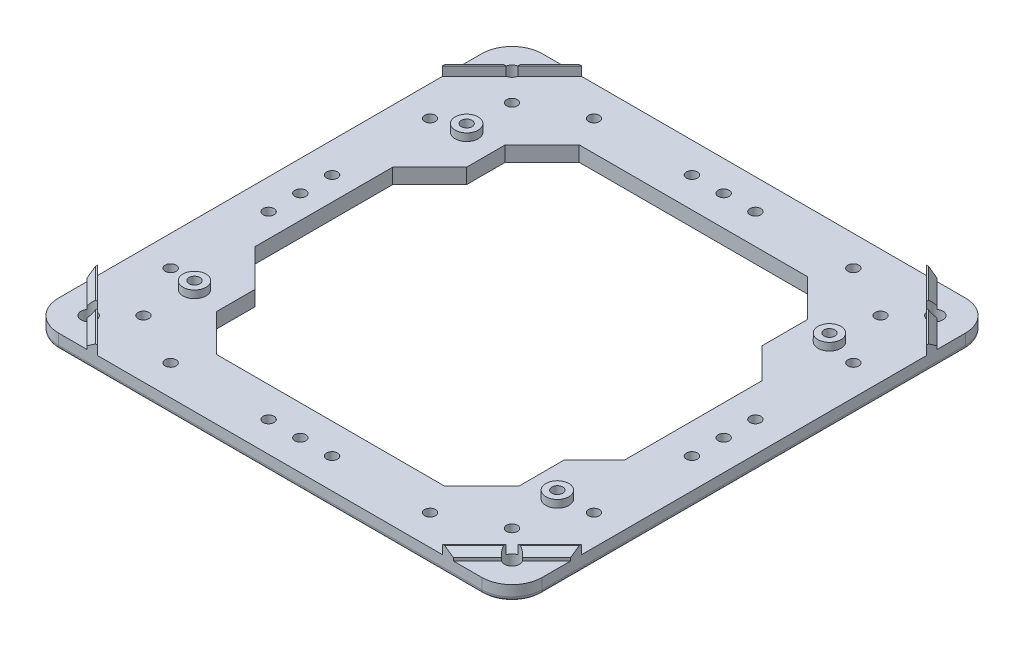
from build123d import *
from build123d.topology import SkipClean

# Parameters (mm, degrees)
SKETCH1_W           = 203.2
SKETCH1_H           = 203.2
BOSS_EXTRUDE1_DEPTH = 6.35
FILLET1_R           = 12.7
SKETCH2_R           = 3.175
CUT_EXTRUDE1_DEPTH  = 288.438345563
FILLET2_R           = 1.905
SKETCH3_R           = 2.286
CUT_EXTRUDE2_DEPTH  = 288.438345634
SKETCH4_R           = 2.286
CUT_EXTRUDE3_DEPTH  = 288.438345634
SKETCH5_R           = 4.826
SKETCH5_R_2         = 2.286
BOSS_EXTRUDE2_DEPTH = 3.175
BOSS_EXTRUDE3_DEPTH = 3.81
CHAMFER1_SIZE       = 2.54
CUT_EXTRUDE4_DEPTH  = 288.438345634
CHAMFER2_SIZE       = 15.5448
SKETCH8_R           = 2.286
CUT_EXTRUDE5_DEPTH  = 288.438345634


with BuildPart() as part:
    # Sketch1 → Boss-Extrude1 (new body)
    with BuildSketch(Plane(origin=(0, 0, 0), x_dir=(1, 0, 0), z_dir=(0, 1, 0))):
        with Locations((101.6, 101.6)):
            Rectangle(SKETCH1_W, SKETCH1_H)
    extrude(amount=BOSS_EXTRUDE1_DEPTH)

    # Fillet1
    fillet1_edges = [part.edges().sort_by_distance(p)[0] for p in [
        (0, 3.175, -203.2),
        (203.2, 3.175, -203.2),
        (203.2, 3.175, 0),
        (0, 3.175, 0),
    ]]
    fillet(fillet1_edges, radius=FILLET1_R)

    # Sketch2 → Cut-Extrude1 (cut, through all)
    with BuildSketch(Plane.XZ):
        with Locations(Location((12.7, -12.7, 0), (0, 0, 270))):
            Circle(SKETCH2_R)
        with Locations(Location((190.5, -12.7, 0), (0, 0, 270))):
            Circle(SKETCH2_R)
        with Locations(Location((190.5, -190.5, 0), (0, 0, 270))):
            Circle(SKETCH2_R)
        with Locations(Location((12.7, -190.5, 0), (0, 0, 270))):
            Circle(SKETCH2_R)
    extrude(amount=-CUT_EXTRUDE1_DEPTH, mode=Mode.SUBTRACT)

    # Fillet2
    fillet2_edges = [part.edges().sort_by_distance(p)[0] for p in [
        (0, 0, -101.6),
        (101.6, 0, -203.2),
        (203.2, 0, -101.6),
        (101.6, 0, 0),
        (199.480256121, 0, -199.480256121),
        (199.480256121, 0, -3.719743879),
        (3.719743879, 0, -3.719743879),
        (3.719743879, 0, -199.480256121),
    ]]
    fillet(fillet2_edges, radius=FILLET2_R)

    # Sketch3 → Cut-Extrude2 (cut, through all)
    with BuildSketch(Plane(origin=(0, 6.35, 0), x_dir=(1, 0, 0), z_dir=(0, 1, 0))):
        with Locations(Location((24.197781122, 24.197781122, 0), (0, 0, 270))):
            Circle(SKETCH3_R)
        with Locations(Location((179.002218878, 179.002218878, 0), (0, 0, 270))):
            Circle(SKETCH3_R)
        with Locations(Location((179.002218878, 24.197781122, 0), (0, 0, 270))):
            Circle(SKETCH3_R)
        with Locations(Location((24.197781122, 179.002218878, 0), (0, 0, 270))):
            Circle(SKETCH3_R)
    extrude(amount=-CUT_EXTRUDE2_DEPTH, mode=Mode.SUBTRACT)

    # Sketch4 → Cut-Extrude3 (cut, through all)
    with BuildSketch(Plane(origin=(0, 6.35, 0), x_dir=(1, 0, 0), z_dir=(0, 1, 0))):
        with Locations(Location((47.117, 12.7, 0), (0, 0, 270))):
            Circle(SKETCH4_R)
        with Locations(Location((156.083, 12.7, 0), (0, 0, 270))):
            Circle(SKETCH4_R)
        with Locations(Location((12.7, 156.083, 0), (0, 0, 270))):
            Circle(SKETCH4_R)
        with Locations(Location((12.7, 47.117, 0), (0, 0, 270))):
            Circle(SKETCH4_R)
        with Locations(Location((156.083, 190.5, 0), (0, 0, 270))):
            Circle(SKETCH4_R)
        with Locations(Location((47.117, 190.5, 0), (0, 0, 270))):
            Circle(SKETCH4_R)
        with Locations(Location((190.5, 47.117, 0), (0, 0, 270))):
            Circle(SKETCH4_R)
        with Locations(Location((190.5, 156.083, 0), (0, 0, 270))):
            Circle(SKETCH4_R)
        with Locations(Location((101.6, 12.7, 0), (0, 0, 270))):
            Circle(SKETCH4_R)
        with Locations(Location((12.7, 101.6, 0), (0, 0, 270))):
            Circle(SKETCH4_R)
        with Locations(Location((101.6, 190.5, 0), (0, 0, 270))):
            Circle(SKETCH4_R)
        with Locations(Location((190.5, 101.6, 0), (0, 0, 270))):
            Circle(SKETCH4_R)
    extrude(amount=-CUT_EXTRUDE3_DEPTH, mode=Mode.SUBTRACT)

    # Sketch5 → Boss-Extrude2 (add)
    # profile 1 of 4: a face of its own
    with BuildSketch(Plane(origin=(0, 6.35, 0), x_dir=(1, 0, 0), z_dir=(0, 1, 0))):
        with Locations(Location((25.4, 158.75, 0), (0, 0, 90))):
            Circle(SKETCH5_R)
        with Locations(Location((25.4, 158.75, 0), (0, 0, 270))):
            Circle(SKETCH5_R_2, mode=Mode.SUBTRACT)
    # profile 2 of 4: a face of its own
    with BuildSketch(Plane(origin=(0, 6.35, 0), x_dir=(1, 0, 0), z_dir=(0, 1, 0))):
        with Locations(Location((177.8, 158.75, 0), (0, 0, 90))):
            Circle(SKETCH5_R)
        with Locations(Location((177.8, 158.75, 0), (0, 0, 270))):
            Circle(SKETCH5_R_2, mode=Mode.SUBTRACT)
    # profile 3 of 4: a face of its own
    with BuildSketch(Plane(origin=(0, 6.35, 0), x_dir=(1, 0, 0), z_dir=(0, 1, 0))):
        with Locations(Location((177.8, 44.45, 0), (0, 0, 90))):
            Circle(SKETCH5_R)
        with Locations(Location((177.8, 44.45, 0), (0, 0, 270))):
            Circle(SKETCH5_R_2, mode=Mode.SUBTRACT)
    # profile 4 of 4: a face of its own
    with BuildSketch(Plane(origin=(0, 6.35, 0), x_dir=(1, 0, 0), z_dir=(0, 1, 0))):
        with Locations(Location((25.4, 44.45, 0), (0, 0, 90))):
            Circle(SKETCH5_R)
        with Locations(Location((25.4, 44.45, 0), (0, 0, 270))):
            Circle(SKETCH5_R_2, mode=Mode.SUBTRACT)
    extrude(amount=BOSS_EXTRUDE2_DEPTH)

    # Sketch6 → Boss-Extrude3 (add)
    with SkipClean():  # the faces are left unmerged after this step: merging them gives an invalid solid
        with BuildSketch(Plane(origin=(0, 6.35, 0), x_dir=(1, 0, 0), z_dir=(0, 1, 0))):
            with BuildLine():
                Line((203.2, 29.12872), (189.886429467, 15.815149467))
                ThreePointArc((189.886429467, 15.815149467), (191.679620112, 15.647731567), (193.093253903, 14.531845843))
                Line((193.093253903, 14.531845843), (203.2, 24.638591939))
                Line((203.2, 24.638591939), (203.2, 29.12872))
            make_face()
            with BuildLine():
                Line((178.561408061, 0), (174.07128, 0))
                Line((174.07128, 0), (187.384850533, 13.313570533))
                ThreePointArc((187.384850533, 13.313570533), (187.552268433, 11.520379888), (188.668154157, 10.106746097))
                Line((188.668154157, 10.106746097), (178.561408061, 0))
            make_face()
            with BuildLine():
                Line((13.313570533, 15.815149467), (0, 29.12872))
                Line((0, 29.12872), (0, 24.638591939))
                Line((0, 24.638591939), (10.106746097, 14.531845843))
                ThreePointArc((10.106746097, 14.531845843), (11.520379888, 15.647731567), (13.313570533, 15.815149467))
            make_face()
            with BuildLine():
                Line((24.638591939, 0), (14.531845843, 10.106746097))
                ThreePointArc((14.531845843, 10.106746097), (15.647731567, 11.520379888), (15.815149467, 13.313570533))
                Line((15.815149467, 13.313570533), (29.12872, 0))
                Line((29.12872, 0), (24.638591939, 0))
            make_face()
            with BuildLine():
                Line((15.815149467, 189.886429467), (29.12872, 203.2))
                Line((29.12872, 203.2), (24.638591939, 203.2))
                Line((24.638591939, 203.2), (14.531845843, 193.093253903))
                ThreePointArc((14.531845843, 193.093253903), (15.647731567, 191.679620112), (15.815149467, 189.886429467))
            make_face()
            with BuildLine():
                Line((0, 178.561408061), (10.106746097, 188.668154157))
                ThreePointArc((10.106746097, 188.668154157), (11.520379888, 187.552268433), (13.313570533, 187.384850533))
                Line((13.313570533, 187.384850533), (0, 174.07128))
                Line((0, 174.07128), (0, 178.561408061))
            make_face()
            with BuildLine():
                Line((189.886429467, 187.384850533), (203.2, 174.07128))
                Line((203.2, 174.07128), (203.2, 178.561408061))
                Line((203.2, 178.561408061), (193.093253903, 188.668154157))
                ThreePointArc((193.093253903, 188.668154157), (191.679620112, 187.552268433), (189.886429467, 187.384850533))
            make_face()
            with BuildLine():
                Line((178.561408061, 203.2), (188.668154157, 193.093253903))
                ThreePointArc((188.668154157, 193.093253903), (187.552268433, 191.679620112), (187.384850533, 189.886429467))
                Line((187.384850533, 189.886429467), (174.07128, 203.2))
                Line((174.07128, 203.2), (178.561408061, 203.2))
            make_face()
        extrude(amount=BOSS_EXTRUDE3_DEPTH)

    # Chamfer1
    chamfer1_edges = [part.edges().sort_by_distance(p)[0] for p in [
        (198.146626952, 10.16, -19.585218891),
        (183.614781109, 10.16, -5.053373048),
        (19.585218891, 10.16, -5.053373048),
        (5.053373048, 10.16, -19.585218891),
        (5.053373048, 10.16, -183.614781109),
        (19.585218891, 10.16, -198.146626952),
        (183.614781109, 10.16, -198.146626952),
        (198.146626952, 10.16, -183.614781109),
    ]]
    chamfer(chamfer1_edges, length=CHAMFER1_SIZE)

    # Sketch7 → Cut-Extrude4 (cut, through all)
    with BuildSketch(Plane(origin=(0, 6.35, 0), x_dir=(1, 0, 0), z_dir=(0, 1, 0))):
        Polygon((38.1, 57.15), (38.1, 25.4), (165.1, 25.4), (165.1, 57.15), (177.8, 57.15), (177.8, 146.05), (165.1, 146.05), (165.1, 177.8), (38.1, 177.8), (38.1, 146.05), (22.56850138, 146.05), (22.56850138, 57.15), align=None)
    extrude(amount=-CUT_EXTRUDE4_DEPTH, mode=Mode.SUBTRACT)

    # Chamfer2
    # the kernel refuses this chamfer: 15.5448 mm, written as the material it adds along each edge
    with BuildSketch(Plane(origin=(22.56850138, 6.35, -57.15), x_dir=(-0.027495876610586303, 0, -0.9996219169112966), z_dir=(0, -1, 0))) as chamfer2_piece_1_section:
        Polygon((CHAMFER2_SIZE * 0.999621916911, CHAMFER2_SIZE * 0.0274958766106), (-CHAMFER2_SIZE * 0.0274958766106, CHAMFER2_SIZE * 0.999621916911), (0, 0), align=None)
    chamfer2_piece_1 = extrude(amount=6.35, mode=Mode.PRIVATE)
    chamfer2_piece_1 = split(chamfer2_piece_1, bisect_by=Plane(origin=(38.1, 3.175, -62.286463207), z_dir=(-1, 0, 0)), keep=Keep.TOP, mode=Mode.PRIVATE)
    add(chamfer2_piece_1)
    with BuildSketch(Plane(origin=(38.1, 6.35, -25.4), x_dir=(-0.027495876610586754, 0, -0.9996219169112966), z_dir=(0, -1, 0)), Plane(origin=(165.1, 6.35, -25.4), x_dir=(-0.9996219169112966, 0, 0.027495876610586292), z_dir=(0, -1, 0)), Plane(origin=(165.1, 6.35, -177.8), x_dir=(0.027495876610586292, 0, 0.9996219169112966), z_dir=(0, -1, 0)), Plane(origin=(38.1, 6.35, -177.8), x_dir=(0.9996219169112966, 0, -0.027495876610586317), z_dir=(0, -1, 0))) as chamfer2_piece_2:
        Polygon((CHAMFER2_SIZE * 0.999621916911, CHAMFER2_SIZE * 0.0274958766106), (-CHAMFER2_SIZE * 0.0274958766106, CHAMFER2_SIZE * 0.999621916911), (0, 0), align=None)
    extrude(amount=6.35)
    with BuildSketch(Plane(origin=(177.8, 6.35, -57.15), x_dir=(-0.9996219169112966, 0, 0.027495876610586292), z_dir=(0, -1, 0))) as chamfer2_piece_3_section:
        Polygon((CHAMFER2_SIZE * 0.999621916911, CHAMFER2_SIZE * 0.0274958766106), (-CHAMFER2_SIZE * 0.0274958766106, CHAMFER2_SIZE * 0.999621916911), (0, 0), align=None)
    chamfer2_piece_3 = extrude(amount=6.35, mode=Mode.PRIVATE)
    chamfer2_piece_3 = split(chamfer2_piece_3, bisect_by=Plane(origin=(165.1, 3.175, -62.494102003), z_dir=(1, 0, 0)), keep=Keep.TOP, mode=Mode.PRIVATE)
    add(chamfer2_piece_3)
    with BuildSketch(Plane(origin=(177.8, 6.35, -146.05), x_dir=(0.027495876610586292, 0, 0.9996219169112966), z_dir=(0, -1, 0))) as chamfer2_piece_4_section:
        Polygon((CHAMFER2_SIZE * 0.999621916911, CHAMFER2_SIZE * 0.0274958766106), (-CHAMFER2_SIZE * 0.0274958766106, CHAMFER2_SIZE * 0.999621916911), (0, 0), align=None)
    chamfer2_piece_4 = extrude(amount=6.35, mode=Mode.PRIVATE)
    chamfer2_piece_4 = split(chamfer2_piece_4, bisect_by=Plane(origin=(165.1, 3.175, -140.705897997), z_dir=(1, 0, 0)), keep=Keep.TOP, mode=Mode.PRIVATE)
    add(chamfer2_piece_4)
    with BuildSketch(Plane(origin=(22.56850138, 6.35, -146.05), x_dir=(0.9996219169112966, 0, -0.027495876610586303), z_dir=(0, -1, 0))) as chamfer2_piece_5_section:
        Polygon((CHAMFER2_SIZE * 0.999621916911, CHAMFER2_SIZE * 0.0274958766106), (-CHAMFER2_SIZE * 0.0274958766106, CHAMFER2_SIZE * 0.999621916911), (0, 0), align=None)
    chamfer2_piece_5 = extrude(amount=6.35, mode=Mode.PRIVATE)
    chamfer2_piece_5 = split(chamfer2_piece_5, bisect_by=Plane(origin=(38.1, 3.175, -140.913536793), z_dir=(-1, 0, 0)), keep=Keep.TOP, mode=Mode.PRIVATE)
    add(chamfer2_piece_5)

    # Sketch8 → Cut-Extrude5 (cut, through all)
    with BuildSketch(Plane(origin=(0, 6.35, 0), x_dir=(1, 0, 0), z_dir=(0, 1, 0))):
        with Locations(Location((88.265, 12.7, 0), (0, 0, 270))):
            Circle(SKETCH8_R)
        with Locations(Location((114.935, 12.7, 0), (0, 0, 270))):
            Circle(SKETCH8_R)
        with Locations(Location((101.6, 12.7, 0), (0, 0, 270))):
            Circle(SKETCH8_R)
        with Locations(Location((12.7, 114.935, 0), (0, 0, 270))):
            Circle(SKETCH8_R)
        with Locations(Location((12.7, 88.265, 0), (0, 0, 270))):
            Circle(SKETCH8_R)
        with Locations(Location((114.935, 190.5, 0), (0, 0, 270))):
            Circle(SKETCH8_R)
        with Locations(Location((88.265, 190.5, 0), (0, 0, 270))):
            Circle(SKETCH8_R)
        with Locations(Location((190.5, 88.265, 0), (0, 0, 270))):
            Circle(SKETCH8_R)
        with Locations(Location((190.5, 114.935, 0), (0, 0, 270))):
            Circle(SKETCH8_R)
    extrude(amount=-CUT_EXTRUDE5_DEPTH, mode=Mode.SUBTRACT)


solid = part.part
